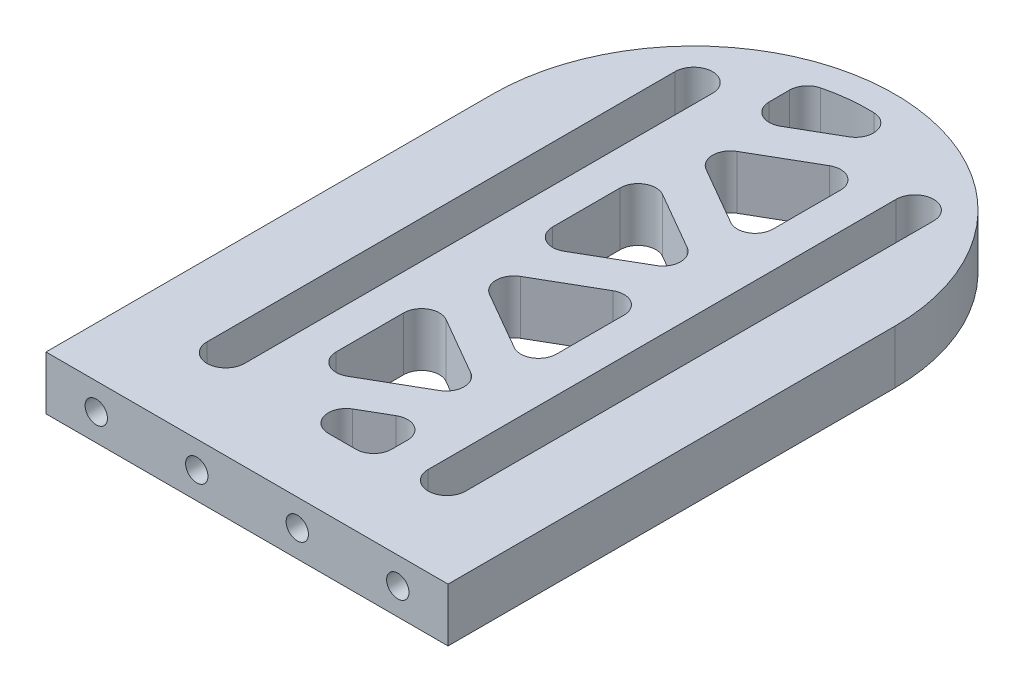
from build123d import *

# Parameters (mm, degrees)
EXTRUDE_1_DEPTH     = 6
CUT_EXTRUDE_1_DEPTH = 56.156595254
CUT_EXTRUDE_2_REACH = 57.157
FILLET_18_R         = 2
M3X0_51_D           = 2.5
M3X0_51_DEPTH       = 8.5
M3X0_51_TIP         = 0.751075774


with BuildPart() as part:
    # Эскиз1 → Бобышка-Вытянуть1 (new body)
    with BuildSketch(Plane(origin=(0, 0, 0), x_dir=(1, 0, 0), z_dir=(0, 1, 0))):
        with BuildLine():
            Line((-22.5, 0), (-22.5, -50))
            Line((-22.5, -50), (22.5, -50))
            Line((22.5, -50), (22.5, 0))
            ThreePointArc((22.5, 0), (0, 22.5), (-22.5, 0))
        make_face()
    extrude(amount=EXTRUDE_1_DEPTH)

    # Эскиз2 → Вырез-Вытянуть1 (cut, through all)
    with BuildSketch(Plane(origin=(0, 6, 0), x_dir=(1, 0, 0), z_dir=(0, 1, 0))):
        with BuildLine():
            Line((-10.274368671, 12.374368671), (-10.274368671, -40))
            ThreePointArc((-10.274368671, -40), (-12.374368671, -42.1), (-14.474368671, -40))
            Line((-14.474368671, -40), (-14.474368671, 12.374368671))
            ThreePointArc((-14.474368671, 12.374368671), (-12.374368671, 14.474368671), (-10.274368671, 12.374368671))
        make_face()
        with BuildLine():
            Line((10.274368671, 12.374368671), (10.274368671, -40))
            ThreePointArc((10.274368671, -40), (12.374368671, -42.1), (14.474368671, -40))
            Line((14.474368671, -40), (14.474368671, 12.374368671))
            ThreePointArc((14.474368671, 12.374368671), (12.374368671, 14.474368671), (10.274368671, 12.374368671))
        make_face()
    extrude(amount=-CUT_EXTRUDE_1_DEPTH, mode=Mode.SUBTRACT)

    # Эскиз11 → Вырез-Вытянуть2 (cut, up to next)
    with BuildSketch(Plane(origin=(0, 6, 0), x_dir=(1, 0, 0), z_dir=(0, 1, 0)), mode=Mode.PRIVATE) as cut_extrude_2_sk1:
        with BuildLine():
            Line((6.274368671, 18.5), (-6.274368671, 11.254983118))
            Line((-6.274368671, 11.254983118), (-6.274368671, 18.5))
            ThreePointArc((-6.274368671, 18.5), (0, 19.535037809), (6.274368671, 18.5))
        make_face()
    cut_extrude_2_tool1 = extrude(cut_extrude_2_sk1.sketch, amount=-CUT_EXTRUDE_2_REACH, mode=Mode.PRIVATE) & part.part
    # Эскиз11 → Вырез-Вытянуть2 (cut, up to next)
    with BuildSketch(Plane(origin=(0, 6, 0), x_dir=(1, 0, 0), z_dir=(0, 1, 0)), mode=Mode.PRIVATE) as cut_extrude_2_sk2:
        Polygon((6.274368671, 13.627163728), (-6.274368671, 6.382146846), (6.274368671, -0.862870036), align=None)
    cut_extrude_2_tool2 = extrude(cut_extrude_2_sk2.sketch, amount=-CUT_EXTRUDE_2_REACH, mode=Mode.PRIVATE) & part.part
    # Эскиз11 → Вырез-Вытянуть2 (cut, up to next)
    with BuildSketch(Plane(origin=(0, 6, 0), x_dir=(1, 0, 0), z_dir=(0, 1, 0)), mode=Mode.PRIVATE) as cut_extrude_2_sk3:
        Polygon((-6.274368671, 1.509310574), (6.274368671, -5.735706308), (-6.274368671, -12.98072319), align=None)
    cut_extrude_2_tool3 = extrude(cut_extrude_2_sk3.sketch, amount=-CUT_EXTRUDE_2_REACH, mode=Mode.PRIVATE) & part.part
    # Эскиз11 → Вырез-Вытянуть2 (cut, up to next)
    with BuildSketch(Plane(origin=(0, 6, 0), x_dir=(1, 0, 0), z_dir=(0, 1, 0)), mode=Mode.PRIVATE) as cut_extrude_2_sk4:
        Polygon((-6.274368671, -17.853559462), (6.274368671, -10.60854258), (6.274368671, -25.098576344), align=None)
    cut_extrude_2_tool4 = extrude(cut_extrude_2_sk4.sketch, amount=-CUT_EXTRUDE_2_REACH, mode=Mode.PRIVATE) & part.part
    # Эскиз11 → Вырез-Вытянуть2 (cut, up to next)
    with BuildSketch(Plane(origin=(0, 6, 0), x_dir=(1, 0, 0), z_dir=(0, 1, 0)), mode=Mode.PRIVATE) as cut_extrude_2_sk5:
        Polygon((-6.274368671, -22.726395734), (6.274368671, -29.971412616), (-6.274368671, -37.216429498), align=None)
    cut_extrude_2_tool5 = extrude(cut_extrude_2_sk5.sketch, amount=-CUT_EXTRUDE_2_REACH, mode=Mode.PRIVATE) & part.part
    # Эскиз11 → Вырез-Вытянуть2 (cut, up to next)
    with BuildSketch(Plane(origin=(0, 6, 0), x_dir=(1, 0, 0), z_dir=(0, 1, 0)), mode=Mode.PRIVATE) as cut_extrude_2_sk6:
        Polygon((-6.274368671, -42.08926577), (6.274368671, -34.844248888), (6.274368671, -42.08926577), align=None)
    cut_extrude_2_tool6 = extrude(cut_extrude_2_sk6.sketch, amount=-CUT_EXTRUDE_2_REACH, mode=Mode.PRIVATE) & part.part
    add(cut_extrude_2_tool1.solids().sort_by_distance((-1.755291, 6, -16.539864))[0], mode=Mode.SUBTRACT)
    add(cut_extrude_2_tool2.solids().sort_by_distance((2.091456, 6, -6.382147))[0], mode=Mode.SUBTRACT)
    add(cut_extrude_2_tool3.solids().sort_by_distance((-2.091456, 6, 5.735706))[0], mode=Mode.SUBTRACT)
    add(cut_extrude_2_tool4.solids().sort_by_distance((2.091456, 6, 17.853559))[0], mode=Mode.SUBTRACT)
    add(cut_extrude_2_tool5.solids().sort_by_distance((-2.091456, 6, 29.971413))[0], mode=Mode.SUBTRACT)
    add(cut_extrude_2_tool6.solids().sort_by_distance((2.091456, 6, 39.67426))[0], mode=Mode.SUBTRACT)

    # Скругление18
    fillet_18_edges = [part.edges().sort_by_distance(p)[0] for p in [
        (6.274368671, 3, 25.098576344),
        (6.274368671, 3, 0.862870036),
        (-6.274368671, 3, -18.5),
        (-6.274368671, 3, -1.509310574),
        (-6.274368671, 3, 22.726395734),
        (-6.274368671, 3, -6.382146846),
        (-6.274368671, 3, 17.853559462),
        (-6.274368671, 3, -11.254983118),
        (-6.274368671, 3, 12.98072319),
        (-6.274368671, 3, 37.216429498),
        (6.274368671, 3, -18.5),
        (6.274368671, 3, 5.735706308),
        (6.274368671, 3, 29.971412616),
        (6.274368671, 3, -13.627163728),
        (6.274368671, 3, 10.60854258),
        (6.274368671, 3, 34.844248888),
        (6.274368671, 3, 42.08926577),
        (-6.274368671, 3, 42.08926577),
    ]]
    fillet(fillet_18_edges, radius=FILLET_18_R)

    # Отверстие обработанное метчиком M3x0.51
    with Locations(Plane.XY.offset(50)):
        with Locations((-16.875, 3), (-5.625, 3), (5.625, 3), (16.875, 3)):
            Hole(M3X0_51_D / 2, depth=M3X0_51_DEPTH)
            with Locations((0, 0, -(M3X0_51_DEPTH + M3X0_51_TIP / 2))):  # 118° drill point
                Cone(0, M3X0_51_D / 2, M3X0_51_TIP, mode=Mode.SUBTRACT)


solid = part.part
